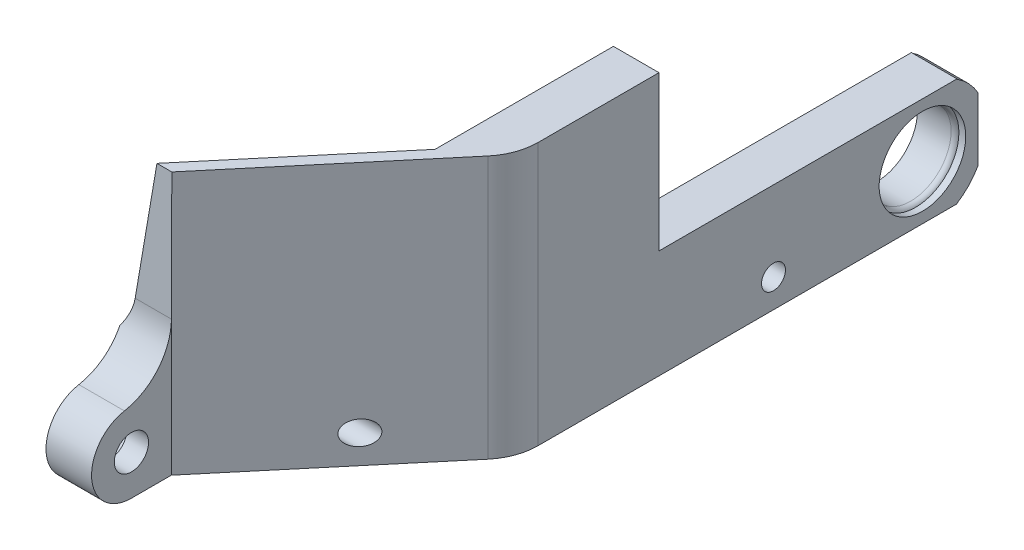
from build123d import *

# Parameters (mm, degrees)
BOSS_EXTRUDE1_DEPTH     = 46.1
CUT_EXTRUDE1_START      = -8
CUT_EXTRUDE1_DEPTH      = 35.707069821
SKETCH3_R               = 5
CUT_EXTRUDE2_DEPTH      = 4.2
SKETCH4_R               = 3
CUT_EXTRUDE3_DEPTH      = 118.073974259
CUT_EXTRUDE4_START      = -33.042265264
CUT_EXTRUDE4_DEPTH      = 39.042265264
CUT_EXTRUDE4_START_2    = 14
CUT_EXTRUDE4_2_DEPTH    = 32.1
CUT_EXTRUDE4_START_3    = -47.726546034
CUT_EXTRUDE4_3_DEPTH    = 7.708156307
SKETCH8_W               = 31
SKETCH8_H               = 27.1
CUT_EXTRUDE5_DEPTH      = 119.273474775
SKETCH9_W               = 8
SKETCH9_H               = 25
BOSS_EXTRUDE2_DEPTH     = 19
SKETCH10_R              = 7.1
CUT_EXTRUDE6_DEPTH      = 119.273474775
SKETCH11_R              = 7.6
CUT_EXTRUDE7_DEPTH      = 1.2
CUT_EXTRUDE8_DEPTH      = 119.273474775
CUT_EXTRUDE8_DEPTH_BACK = 119.273474775
SKETCH12_R              = 2.1
CUT_EXTRUDE9_DEPTH      = 4.2
CUT_EXTRUDE9_DEPTH_BACK = 119.273474775
CUT_EXTRUDE9_START      = -8
SKETCH14_R              = 4
SKETCH14_R_2            = 2.1
CUT_EXTRUDE10_START     = -24
SKETCH14_3_R            = 4
CUT_EXTRUDE10_DEPTH     = 4.2
FILLET13_R              = 10
FILLET14_R              = 1


with BuildPart() as part:
    # Sketch1 → Boss-Extrude1 (new body)
    with BuildSketch(Plane(origin=(0, 0, 0), x_dir=(1, 0, 0), z_dir=(0, 1, 0))):
        with BuildLine():
            Line((0, 0), (8, 0))
            Line((8, 0), (8, -52.240297657))
            ThreePointArc((8, -52.240297657), (7.396926208, -55.660499091), (5.660444431, -58.668173754))
            Line((5.660444431, -58.668173754), (-19.707069821, -88.9))
            Line((-19.707069821, -88.9), (-19.707069821, -102.9))
            Line((-19.707069821, -102.9), (-27.707069821, -102.9))
            Line((-27.707069821, -102.9), (-27.707069821, -88.9))
            Line((-27.707069821, -88.9), (-2.339555569, -58.668173754))
            ThreePointArc((-2.339555569, -58.668173754), (-0.603073792, -55.660499091), (0, -52.240297657))
            Line((0, -52.240297657), (0, 0))
        make_face()
    extrude(amount=BOSS_EXTRUDE1_DEPTH)

    # Cut-Extrude1: read off the stored shape, not the designer's step
    # Cut-Extrude1 outline → Cut-Extrude1 (cut)
    with BuildSketch(Plane(origin=(-19.707069821, 0, 0), x_dir=(0, 0, -1), z_dir=(1, 0, 0)).offset(CUT_EXTRUDE1_START)):
        with BuildLine():
            ThreePointArc((-95.9, 0), (-100.849747468, 2.050252532), (-102.9, 7))
            Line((-102.9, 7), (-102.9, 0))
            Line((-102.9, 0), (-95.9, 0))
        make_face()
        with BuildLine():
            ThreePointArc((-102.9, 7), (-100.849747468, 11.949747468), (-95.9, 14))
            Line((-95.9, 14), (-88.9, 14))
            Line((-88.9, 14), (-88.852375001, 46.1))
            Line((-88.852375001, 46.1), (-102.9, 46.1))
            Line((-102.9, 46.1), (-102.9, 7))
        make_face()
    extrude(amount=CUT_EXTRUDE1_DEPTH, mode=Mode.SUBTRACT)

    # Sketch3 → Cut-Extrude2 (cut)
    with BuildSketch(Plane.ZY.offset(27.707069821)):
        with Locations((95.9, 7)):
            Circle(SKETCH3_R)
    extrude(amount=-CUT_EXTRUDE2_DEPTH, mode=Mode.SUBTRACT)

    # Sketch4 → Cut-Extrude3 (cut, through all)
    with BuildSketch(Plane.ZY.offset(23.507069821)):
        with Locations((95.9, 7)):
            Circle(SKETCH4_R)
    extrude(amount=-CUT_EXTRUDE3_DEPTH, mode=Mode.SUBTRACT)

    # Cut-Extrude4: read off the stored shape, not the designer's step
    # Cut-Extrude4 outline → Cut-Extrude4 (cut)
    with BuildSketch(Plane(origin=(-51.917191151, 0, 61.872499072), x_dir=(0.7660444431189772, 0, 0.6427876096865404), z_dir=(-0.6427876096865403, 0, 0.7660444431189771)).offset(CUT_EXTRUDE4_START)):
        Polygon((35.918971629, 46.1), (35.918971629, 14), (40.047327174, 46.1), align=None)
    extrude(amount=CUT_EXTRUDE4_DEPTH, mode=Mode.SUBTRACT)

    # Cut-Extrude4 2 outline → Cut-Extrude4 2 (cut)
    with BuildSketch(Plane(origin=(0, 0, 0), x_dir=(1, 0, 0), z_dir=(0, 1, 0)).offset(CUT_EXTRUDE4_START_2)):
        with BuildLine():
            Line((-3.162503825, -59.648925294), (0, -62.302581087))
            Line((0, -62.302581087), (0, -52.240297657))
            ThreePointArc((0, -52.240297657), (-0.603073792, -55.66049909), (-2.339555569, -58.668173754))
            Line((-2.339555569, -58.668173754), (-3.162503825, -59.648925294))
        make_face()
    extrude(amount=CUT_EXTRUDE4_2_DEPTH, mode=Mode.SUBTRACT)

    # Cut-Extrude4 3 outline → Cut-Extrude4 3 (add)
    with BuildSketch(Plane(origin=(0, 0, 0), x_dir=(0.7660444431189768, 0, 0.6427876096865408), z_dir=(0.6427876096865408, 0, -0.7660444431189768)).offset(CUT_EXTRUDE4_START_3)):
        Polygon((40.047327174, -46.1), (40.047327174, -14), (35.918971629, -14), align=None)
    extrude(amount=CUT_EXTRUDE4_3_DEPTH)

    # Sketch8 → Cut-Extrude5 (cut, through all)
    with BuildSketch(Plane(origin=(8, 0, 0), x_dir=(0, 0, -1), z_dir=(1, 0, 0))):
        with Locations((-15.5, 32.55)):
            Rectangle(SKETCH8_W, SKETCH8_H)
    extrude(amount=-CUT_EXTRUDE5_DEPTH, mode=Mode.SUBTRACT)

    # Sketch9 → Boss-Extrude2 (add)
    with BuildSketch(Plane(origin=(0, 0, 0), x_dir=(1, 0, 0), z_dir=(0, 1, 0))):
        with Locations((4, 12.5)):
            Rectangle(SKETCH9_W, SKETCH9_H)
    extrude(amount=BOSS_EXTRUDE2_DEPTH)

    # Sketch10 → Cut-Extrude6 (cut, through all)
    with BuildSketch(Plane(origin=(8, 0, 0), x_dir=(0, 0, -1), z_dir=(1, 0, 0))):
        with BuildLine():
            ThreePointArc((25, 3.947892292), (23.353975422, 1.740233099), (21.219790616, 0))
            Line((21.219790616, 0), (25, 0))
            Line((25, 0), (25, 3.947892292))
        make_face()
        with BuildLine():
            ThreePointArc((21.286823186, 18.957545444), (23.381362589, 17.231063475), (25, 15.052107708))
            Line((25, 15.052107708), (25, 19))
            Line((25, 19), (21.313922252, 19))
            Line((21.313922252, 19), (21.286823186, 18.957545444))
        make_face()
        with Locations((15.25, 9.5)):
            Circle(SKETCH10_R)
    extrude(amount=-CUT_EXTRUDE6_DEPTH, mode=Mode.SUBTRACT)

    # Sketch11 → Cut-Extrude7 (cut)
    with BuildSketch(Plane(origin=(8, 0, 0), x_dir=(0, 0, -1), z_dir=(1, 0, 0))):
        with Locations((15.25, 9.5)):
            Circle(SKETCH11_R)
    extrude(amount=-CUT_EXTRUDE7_DEPTH, mode=Mode.SUBTRACT)

    # Sketch12 → Cut-Extrude8 (cut, two sides: drawn at the far end of the back side and taken through both)
    with BuildSketch(Plane(origin=(8, 0, 0), x_dir=(0, 0, -1), z_dir=(1, 0, 0)).offset(-CUT_EXTRUDE8_DEPTH_BACK)):
        with Locations((-70.9, 5)):
            Circle(SKETCH12_R)
        with Locations((-10.9, 5)):
            Circle(SKETCH12_R)
    extrude(amount=CUT_EXTRUDE8_DEPTH + CUT_EXTRUDE8_DEPTH_BACK, mode=Mode.SUBTRACT)

    # Sketch14 → Cut-Extrude9 (cut, two sides: drawn at the far end of the back side and taken through both)
    with BuildSketch(Plane(origin=(8, 0, 0), x_dir=(0, 0, -1), z_dir=(1, 0, 0)).offset(CUT_EXTRUDE9_START - CUT_EXTRUDE9_DEPTH_BACK)):
        with Locations((-10.9, 5)):
            Circle(SKETCH14_R)
        with Locations((-10.9, 5)):
            Circle(SKETCH14_R_2, mode=Mode.SUBTRACT)
    extrude(amount=CUT_EXTRUDE9_DEPTH + CUT_EXTRUDE9_DEPTH_BACK, mode=Mode.SUBTRACT)

    # Sketch14<3> → Cut-Extrude10 (cut)
    with BuildSketch(Plane(origin=(8, 0, 0), x_dir=(0, 0, -1), z_dir=(1, 0, 0)).offset(CUT_EXTRUDE10_START)):
        with Locations((-70.9, 5)):
            Circle(SKETCH14_3_R)
    extrude(amount=CUT_EXTRUDE10_DEPTH, mode=Mode.SUBTRACT)

    # Fillet13
    # the kernel refuses this fillet: 10 mm, written as the material it adds along each edge
    with BuildSketch(Plane(origin=(-27.707069821, 14, 88.9), x_dir=(0, 0.9999988994008282, -0.0014836431957626689), z_dir=(1, 0, 0))) as fillet13_piece_1_section:
        with BuildLine():
            CenterArc((9.720956062, 10), FILLET13_R, 190.199837756, 79.800162244)
            Line((-0.121005032, 8.229180466), (-1.105201142, 8.052098513))
            ThreePointArc((-1.105201142, 8.052098513), (-1.010384402, 6.998508652), (-0.999998899, -0.001483643))
            Line((-0.999998899, -0.001483643), (0, -1))
            Line((0, -1), (9.720956062, -1))
            Line((9.720956062, -1), (9.720956062, 0))
        make_face()
    fillet13_piece_1 = extrude(amount=8, mode=Mode.PRIVATE)
    fillet13_piece_1 = split(fillet13_piece_1, bisect_by=Plane(origin=(-27.707069822, 14, 88.9), z_dir=(0.75978665319281, -0.12755860295201663, 0.6375367004675092)), keep=Keep.TOP, mode=Mode.PRIVATE)
    fillet13_piece_1 = split(fillet13_piece_1, bisect_by=Plane(origin=(-27.707069821, 14, 88.9), z_dir=(0.7660444431189771, 0, 0.6427876096865404)), keep=Keep.TOP, mode=Mode.PRIVATE)
    fillet13_piece_1 = split(fillet13_piece_1, bisect_by=Plane(origin=(-23.012477111, 14, 92.839231012), z_dir=(-0.7660444431189769, 0, -0.6427876096865407)), keep=Keep.TOP, mode=Mode.PRIVATE)
    add(fillet13_piece_1)
    with BuildSketch(Plane(origin=(-27.707069821, 14, 88.9), x_dir=(0, 0.9999988994008282, -0.0014836431957626689), z_dir=(1, 0, 0))) as fillet13_piece_2_section:
        with BuildLine():
            CenterArc((9.720956062, 10), FILLET13_R, 190.199837756, 79.800162244)
            Line((-0.121005032, 8.229180466), (-1.105201142, 8.052098513))
            ThreePointArc((-1.105201142, 8.052098513), (-1.010384402, 6.998508652), (-0.999998899, -0.001483643))
            Line((-0.999998899, -0.001483643), (0, -1))
            Line((0, -1), (9.720956062, -1))
            Line((9.720956062, -1), (9.720956062, 0))
        make_face()
    fillet13_piece_2 = extrude(amount=8, mode=Mode.PRIVATE)
    fillet13_piece_2 = split(fillet13_piece_2, bisect_by=Plane(origin=(-23.012477111, 14, 92.839231012), z_dir=(0.7660444431189769, 0, 0.6427876096865407)), keep=Keep.TOP, mode=Mode.PRIVATE)
    add(fillet13_piece_2)
    with BuildSketch(Plane(origin=(-27.707069821, 14, 88.9), x_dir=(0, 0.9999988994008282, -0.0014836431957626689), z_dir=(1, 0, 0))) as fillet13_piece_3_section:
        with BuildLine():
            CenterArc((9.720956062, 10), FILLET13_R, 190.199837756, 79.800162244)
            Line((-0.121005032, 8.229180466), (-1.105201142, 8.052098513))
            ThreePointArc((-1.105201142, 8.052098513), (-1.010384402, 6.998508652), (-0.999998899, -0.001483643))
            Line((-0.999998899, -0.001483643), (0, -1))
            Line((0, -1), (9.720956062, -1))
            Line((9.720956062, -1), (9.720956062, 0))
        make_face()
    fillet13_piece_3 = extrude(amount=32.302390155, mode=Mode.PRIVATE)
    fillet13_piece_3 = split(fillet13_piece_3, bisect_by=Plane(origin=(-19.707069821, 14, 88.9), z_dir=(1, 0, 0)), keep=Keep.TOP, mode=Mode.PRIVATE)
    fillet13_piece_3 = split(fillet13_piece_3, bisect_by=Plane(origin=(-23.012477111, 14, 92.839231012), z_dir=(-0.7660444431189769, 0, -0.6427876096865407)), keep=Keep.TOP, mode=Mode.PRIVATE)
    add(fillet13_piece_3)

    # Fillet14
    # the kernel refuses this fillet: 1 mm, written as the material it takes off along each edge
    with BuildSketch(Plane(origin=(6.8, 9.5, -15.25), x_dir=(0, 0, -1), z_dir=(0, -1, 0))) as fillet14_piece_1:
        with BuildLine():
            CenterArc((8.1, -0.866025404), FILLET14_R, 120, 60)
            Line((7.1, -0.866025404), (7.08, -0.866025404))
            Line((7.08, -0.866025404), (7.08, 0))
            Line((7.08, 0), (7.1, 0.02))
            ThreePointArc((7.1, 0.02), (7.35, 0.02), (7.59, 0.017320508))
            Line((7.59, 0.017320508), (7.6, 0))
        make_face()
    revolve(axis=Axis((6.8, 9.5, -15.25), (1, 0, 0)), mode=Mode.SUBTRACT)


solid = part.part
